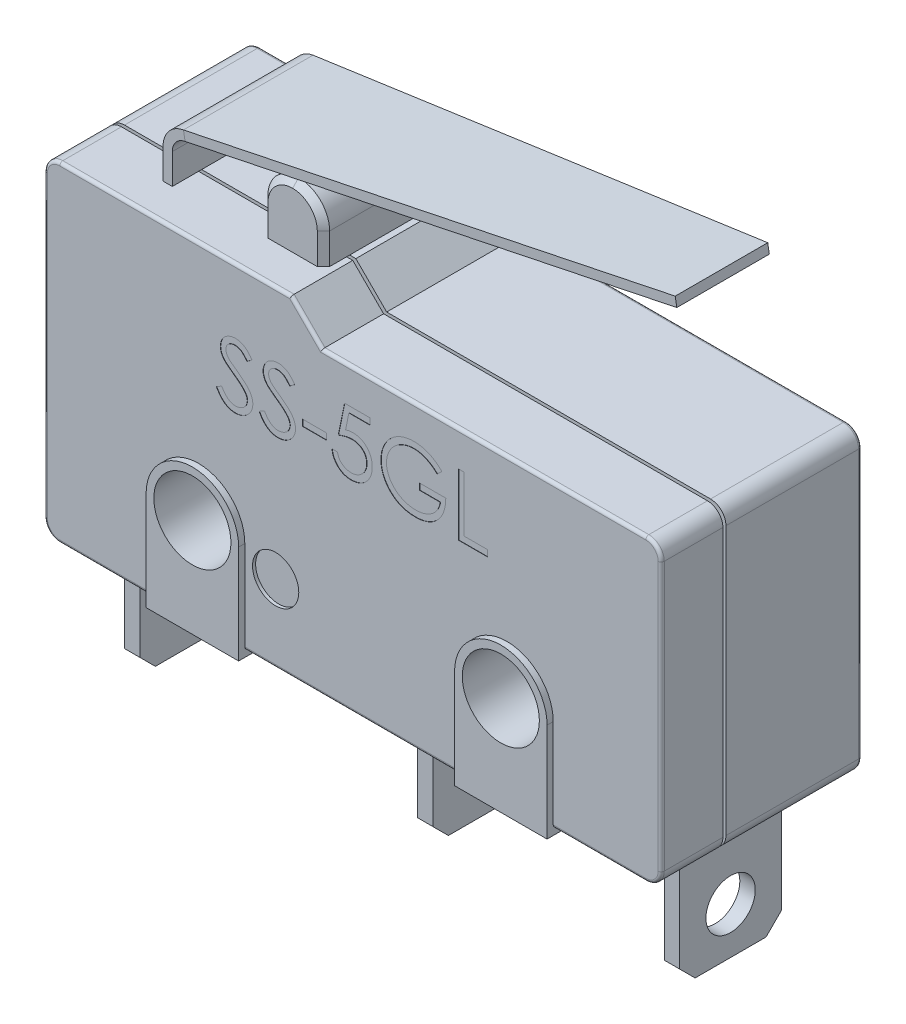
from build123d import *

# Parameters (mm, degrees)
EXTRUDE_1_DEPTH     = 6.5
SKETCH_2_R          = 1.25
CUT_EXTRUDE_1_DEPTH = 24.595338523
EXTRUDE_START       = 0.2
SKETCH_3_R          = 1.25
EXTRUDE_2_DEPTH     = 0.2
SKETCH_4_R          = 1.25
EXTRUDE_3_DEPTH     = 0.2
SKETCH_5_W          = 2
SKETCH_5_H          = 4
EXTRUDE_4_DEPTH     = 2
FILLET_1_R          = 1
EXTRUDE_5_DEPTH     = 4.2
CUT_EXTRUDE_2_DEPTH = 0.3
SKETCH_8_W          = 0.5
SKETCH_8_H          = 3.3
EXTRUDE_6_DEPTH     = 4
EXTRUDE_6_2_DEPTH   = 4
EXTRUDE_6_3_DEPTH   = 4
SKETCH_9_R          = 0.8
CUT_EXTRUDE_3_DEPTH = 26.221709024
CUT_EXTRUDE_4_DEPTH = 26.221709024
SKETCH_12_W         = 3
SKETCH_12_H         = 6.9
EXTRUDE_7_DEPTH     = 0.2
FILLET_2_R          = 0.5
SKETCH_13_W         = 0.769230769
SKETCH_13_H         = 0.205128205
CUT_EXTRUDE_5_DEPTH = 0.01
CHAMFER_2_SIZE      = 0.2
FILLET_3_R          = 0.1
SKETCH_14_R         = 0.75
CUT_EXTRUDE_6_DEPTH = 0.1
CUT_EXTRUDE_START   = -0.1
SKETCH_15_R         = 0.75
CUT_EXTRUDE_7_DEPTH = 0.1
CUT_EXTRUDE_8_DEPTH = 0.1


with BuildPart() as part:
    # 草圖1 → 填料-伸長1 (new body)
    with BuildSketch(Plane.XY):
        Polygon((20, 9.7), (9, 9.7), (8, 10.7), (0, 10.7), (0, 0), (20, 0), align=None)
    extrude(amount=EXTRUDE_1_DEPTH)

    # 草圖2 → 除料-伸長1 (cut, through all)
    with BuildSketch(Plane.XY.offset(6.5)):
        with Locations((5, 3)):
            Circle(SKETCH_2_R)
        with Locations((15, 3)):
            Circle(SKETCH_2_R)
    extrude(amount=-CUT_EXTRUDE_1_DEPTH, mode=Mode.SUBTRACT)

    # 草圖3 → 填料-伸長2 (add)
    # profile 1 of 2: a face of its own
    with BuildSketch(Plane.XY.offset(6.5).offset(EXTRUDE_START)):
        with BuildLine():
            Line((3.5, 3), (3.5, 0))
            Line((3.5, 0), (6.5, 0))
            Line((6.5, 0), (6.5, 3))
            ThreePointArc((6.5, 3), (5, 4.5), (3.5, 3))
        make_face()
        with Locations((5, 3)):
            Circle(SKETCH_3_R, mode=Mode.SUBTRACT)
    # profile 2 of 2: a face of its own
    with BuildSketch(Plane.XY.offset(6.5).offset(EXTRUDE_START)):
        with BuildLine():
            Line((13.5, 3), (13.5, 0))
            Line((13.5, 0), (16.5, 0))
            Line((16.5, 0), (16.5, 3))
            ThreePointArc((16.5, 3), (15, 4.5), (13.5, 3))
        make_face()
        with Locations((15, 3)):
            Circle(SKETCH_3_R, mode=Mode.SUBTRACT)
    extrude(amount=-EXTRUDE_2_DEPTH)

    # 草圖4 → 填料-伸長3 (add)
    # profile 1 of 2: a face of its own
    with BuildSketch(Plane(origin=(0, 0, 0), x_dir=(-1, 0, 0), z_dir=(0, 0, -1))):
        with BuildLine():
            Line((-16.5, 3), (-16.5, 0))
            Line((-16.5, 0), (-13.5, 0))
            Line((-13.5, 0), (-13.5, 3))
            ThreePointArc((-13.5, 3), (-15, 4.5), (-16.5, 3))
        make_face()
        with Locations(Location((-15, 3, 0), (0, 0, 180))):
            Circle(SKETCH_4_R, mode=Mode.SUBTRACT)
    # profile 2 of 2: a face of its own
    with BuildSketch(Plane(origin=(0, 0, 0), x_dir=(-1, 0, 0), z_dir=(0, 0, -1))):
        with BuildLine():
            Line((-6.5, 3), (-6.5, 0))
            Line((-6.5, 0), (-3.5, 0))
            Line((-3.5, 0), (-3.5, 3))
            ThreePointArc((-3.5, 3), (-5, 4.5), (-6.5, 3))
        make_face()
        with Locations(Location((-5, 3, 0), (0, 0, 180))):
            Circle(SKETCH_4_R, mode=Mode.SUBTRACT)
    extrude(amount=EXTRUDE_3_DEPTH)

    # 草圖12 → 填料-伸長7 (add)
    with BuildSketch(Plane.XZ):
        with Locations((5, 3.25)):
            Rectangle(SKETCH_12_W, SKETCH_12_H)
        with Locations((15, 3.25)):
            Rectangle(SKETCH_12_W, SKETCH_12_H)
    extrude(amount=EXTRUDE_7_DEPTH)

    # 圓角2
    fillet_2_edges = [part.edges().sort_by_distance(p)[0] for p in [
        (20, 9.7, 3.25),
        (20, 0, 3.25),
        (0, 0, 3.25),
        (0, 10.7, 3.25),
    ]]
    fillet(fillet_2_edges, radius=FILLET_2_R)

    # 草圖13 → 除料-伸長5 (cut)
    with BuildSketch(Plane.XY.offset(6.5)):
        with BuildLine():
            Line((5.580376832, 6.943678056), (5.749447345, 7.045040235))
            add(Edge.make_bspline(
                [(5.749447345, 7.045040235), (5.765172052, 7.01871773), (5.795299983, 6.968284825), (5.845557903, 6.900137373), (5.897633852, 6.84221614), (5.951913471, 6.794858079), (6.008065442, 6.757573001), (6.06645633, 6.731171726), (6.126889364, 6.714705454), (6.168017262, 6.712705404), (6.188549909, 6.711706902)],
                knots=[0, 0, 0, 0, 1.272034388, 2.437168799, 3.508375237, 4.49857839, 5.41946034, 6.295179144, 7.148887113, 8, 8, 8, 8], degree=3))
            add(Edge.make_bspline(
                [(6.188549909, 6.711706902), (6.206085258, 6.712195286), (6.240849128, 6.713163509), (6.292027552, 6.722466825), (6.341731439, 6.73675947), (6.388936375, 6.757228574), (6.432991012, 6.781993423), (6.47162341, 6.811905524), (6.505021188, 6.845394784), (6.532340683, 6.882756301), (6.553300703, 6.922937529), (6.569410456, 6.96418093), (6.578350498, 7.007134397), (6.579697214, 7.036054662), (6.580376832, 7.05064921)],
                knots=[0, 0, 0, 0, 1.095163259, 2.171163733, 3.241058638, 4.321873601, 5.38011039, 6.391990106, 7.366004449, 8.327778327, 9.272591725, 10.192022065, 11.087607919, 12, 12, 12, 12], degree=3))
            add(Edge.make_bspline(
                [(6.580376832, 7.05064921), (6.579534369, 7.067301124), (6.577821764, 7.101152032), (6.563346632, 7.151094691), (6.540575634, 7.200519016), (6.519568409, 7.231091168), (6.508662088, 7.246963312)],
                knots=[0, 0, 0, 0, 0.938893495, 1.908633276, 2.914225137, 4, 4, 4, 4], degree=3))
            add(Edge.make_bspline(
                [(6.508662088, 7.246963312), (6.499707452, 7.25841864), (6.480908312, 7.282467668), (6.448589733, 7.318264945), (6.410666239, 7.355189756), (6.368435637, 7.394652074), (6.320359586, 7.434816529), (6.267943863, 7.477598403), (6.20985023, 7.521370732), (6.16910766, 7.550726484), (6.148085165, 7.565873569)],
                knots=[0, 0, 0, 0, 0.722233717, 1.516239348, 2.393582979, 3.351407094, 4.387010283, 5.505090956, 6.712668013, 8, 8, 8, 8], degree=3))
            add(Edge.make_bspline(
                [(6.148085165, 7.565873569), (6.127042882, 7.580861333), (6.086811638, 7.609516797), (6.030549591, 7.652044959), (5.980238469, 7.690927171), (5.936101888, 7.726529463), (5.898159261, 7.758856666), (5.866111598, 7.787598345), (5.84077528, 7.813531809), (5.826686376, 7.830355433), (5.820360806, 7.837908825)],
                knots=[0, 0, 0, 0, 1.452282411, 2.77665338, 3.964542531, 5.026858415, 5.96415736, 6.766646006, 7.446254459, 8, 8, 8, 8], degree=3))
            add(Edge.make_bspline(
                [(5.820360806, 7.837908825), (5.811519352, 7.849680846), (5.794131445, 7.872832105), (5.771179442, 7.909017738), (5.751671349, 7.946059604), (5.736378588, 7.984057241), (5.723500748, 8.022477201), (5.714839074, 8.06182077), (5.709415418, 8.101911409), (5.708859997, 8.128890552), (5.70858196, 8.142396005)],
                knots=[0, 0, 0, 0, 1.068054152, 2.10047183, 3.106115577, 4.101338837, 5.06977816, 6.043150881, 7.020423561, 8, 8, 8, 8], degree=3))
            add(Edge.make_bspline(
                [(5.70858196, 8.142396005), (5.709327794, 8.163555876), (5.710803519, 8.205423341), (5.723283815, 8.266583815), (5.742982611, 8.324976054), (5.77057969, 8.380021959), (5.80615532, 8.430288233), (5.847324449, 8.476353083), (5.896359584, 8.515077987), (5.950161083, 8.548913449), (6.009050438, 8.575396835), (6.070759526, 8.595374538), (6.135386424, 8.606694114), (6.179159644, 8.608318551), (6.201370422, 8.609142799)],
                knots=[0, 0, 0, 0, 1.005424448, 1.989358655, 2.955360095, 3.929531133, 4.905563448, 5.876582895, 6.856512386, 7.866279853, 8.892233794, 9.918561126, 10.94386622, 12, 12, 12, 12], degree=3))
            add(Edge.make_bspline(
                [(6.201370422, 8.609142799), (6.224938479, 8.608329913), (6.271807823, 8.606713341), (6.340750232, 8.592657609), (6.407127784, 8.569400082), (6.460523935, 8.543006563), (6.502314085, 8.516645754), (6.534184218, 8.492634426), (6.566479904, 8.464991507), (6.599461649, 8.433643366), (6.632570598, 8.398302365), (6.666298285, 8.359210543), (6.700723581, 8.316606797), (6.722869787, 8.286192796), (6.734222986, 8.270601133)],
                knots=[0, 0, 0, 0, 1.286793592, 2.559021753, 3.825965368, 5.121522368, 5.803751409, 6.523245864, 7.299691795, 8.125521123, 9.008227632, 9.944561021, 10.946284179, 12, 12, 12, 12], degree=3))
            Line((6.734222986, 8.270601133), (6.57196337, 8.147604338))
            add(Edge.make_bspline(
                [(6.57196337, 8.147604338), (6.562165695, 8.160226447), (6.543297662, 8.184533677), (6.514652241, 8.218574429), (6.487653014, 8.24966956), (6.461052785, 8.276678205), (6.436256424, 8.301079424), (6.412189543, 8.321970713), (6.389198485, 8.339556768), (6.360217393, 8.358324516), (6.323807269, 8.376928233), (6.278101819, 8.392670563), (6.230338234, 8.402130598), (6.197807016, 8.403381391), (6.18133837, 8.404014594)],
                knots=[0, 0, 0, 0, 1.181633172, 2.275549214, 3.290209073, 4.226197932, 5.078386478, 5.862611352, 6.581680152, 7.217281963, 8.414376989, 9.595101626, 10.782541182, 12, 12, 12, 12], degree=3))
            add(Edge.make_bspline(
                [(6.18133837, 8.404014594), (6.1606775, 8.403322194), (6.120834959, 8.401986966), (6.06426911, 8.387404117), (6.013358295, 8.364443054), (5.969613973, 8.332263067), (5.933192843, 8.294136785), (5.906846866, 8.250263154), (5.890989629, 8.201816067), (5.889054613, 8.168020835), (5.88806914, 8.150809466)],
                knots=[0, 0, 0, 0, 1.14458467, 2.207223713, 3.21896685, 4.227309161, 5.202851033, 6.127160689, 7.046193047, 8, 8, 8, 8], degree=3))
            add(Edge.make_bspline(
                [(5.88806914, 8.150809466), (5.888293783, 8.140094335), (5.888743438, 8.118646553), (5.895014751, 8.086960026), (5.903071511, 8.055353546), (5.915838729, 8.023969213), (5.933464617, 7.992258151), (5.956610431, 7.959674301), (5.985760895, 7.925930468), (6.008090617, 7.903983397), (6.019880037, 7.892396005)],
                knots=[0, 0, 0, 0, 0.858281714, 1.717966888, 2.583508476, 3.4729293, 4.427298488, 5.488583878, 6.674047936, 8, 8, 8, 8], degree=3))
            add(Edge.make_bspline(
                [(6.019880037, 7.892396005), (6.024257964, 7.888489133), (6.034658917, 7.879207299), (6.053673731, 7.86401171), (6.078783902, 7.845267269), (6.109333731, 7.822074517), (6.145886509, 7.795170824), (6.188446256, 7.764900189), (6.23653856, 7.730279926), (6.270665369, 7.706075617), (6.288710165, 7.693277415)],
                knots=[0, 0, 0, 0, 0.420754252, 0.999615792, 1.744751191, 2.668019286, 3.750313428, 4.999500688, 6.413464383, 8, 8, 8, 8], degree=3))
            add(Edge.make_bspline(
                [(6.288710165, 7.693277415), (6.310416401, 7.677482352), (6.352447519, 7.646897403), (6.412251851, 7.600945585), (6.466476884, 7.556004003), (6.515313, 7.512359656), (6.559242662, 7.470343603), (6.597778503, 7.429450357), (6.631313177, 7.389972887), (6.667415588, 7.339359987), (6.70430577, 7.277199367), (6.735986632, 7.201040374), (6.75596283, 7.124585334), (6.758575125, 7.07319857), (6.759864011, 7.047844722)],
                knots=[0, 0, 0, 0, 1.163667725, 2.253281268, 3.268753668, 4.215851969, 5.092017293, 5.902905408, 6.650798638, 7.335211899, 8.59617414, 9.77448103, 10.901945474, 12, 12, 12, 12], degree=3))
            add(Edge.make_bspline(
                [(6.759864011, 7.047844722), (6.759488504, 7.029914228), (6.758744781, 6.994401438), (6.750195687, 6.942255679), (6.737670164, 6.891609468), (6.718791745, 6.843088832), (6.69574994, 6.795806111), (6.666512084, 6.751001596), (6.632621979, 6.707683654), (6.593745542, 6.667007374), (6.551205026, 6.62966669), (6.506242915, 6.596450084), (6.458785616, 6.568753899), (6.409090578, 6.546153418), (6.357146386, 6.528477122), (6.302970509, 6.515669768), (6.246473645, 6.507809362), (6.20807337, 6.506993498), (6.188549909, 6.506578697)],
                knots=[0, 0, 0, 0, 0.983748083, 1.948392443, 2.894712957, 3.844097841, 4.80183111, 5.778335162, 6.776009319, 7.81870978, 8.863265674, 9.881300176, 10.883814829, 11.87499822, 12.874611388, 13.892143829, 14.928324115, 16, 16, 16, 16], degree=3))
            add(Edge.make_bspline(
                [(6.188549909, 6.506578697), (6.173443998, 6.506870801), (6.143422421, 6.507451329), (6.099017003, 6.51258349), (6.055508666, 6.519844692), (6.013443362, 6.531372732), (5.972279127, 6.545359576), (5.932194993, 6.56258148), (5.893171534, 6.583219881), (5.854990058, 6.606817038), (5.817747672, 6.634278606), (5.781793691, 6.666263461), (5.745948442, 6.701889464), (5.71126993, 6.742124072), (5.677056704, 6.786317262), (5.643983327, 6.83488251), (5.611365203, 6.887555283), (5.590899221, 6.924621046), (5.580376832, 6.943678056)],
                knots=[0, 0, 0, 0, 0.915332311, 1.819136955, 2.706846663, 3.586547465, 4.459518054, 5.340707479, 6.227863349, 7.133153174, 8.059268498, 9.028702269, 10.047606654, 11.120612155, 12.245963614, 13.433783089, 14.680604001, 16, 16, 16, 16], degree=3))
        make_face()
        with BuildLine():
            Line((6.964992216, 6.943678056), (7.134062729, 7.045040235))
            add(Edge.make_bspline(
                [(7.134062729, 7.045040235), (7.149787436, 7.01871773), (7.179915368, 6.968284825), (7.230173288, 6.900137373), (7.282249237, 6.84221614), (7.336528856, 6.794858079), (7.392680826, 6.757573001), (7.451071714, 6.731171726), (7.511504749, 6.714705454), (7.552632647, 6.712705404), (7.573165293, 6.711706902)],
                knots=[0, 0, 0, 0, 1.272034388, 2.437168799, 3.508375237, 4.49857839, 5.41946034, 6.295179144, 7.148887113, 8, 8, 8, 8], degree=3))
            add(Edge.make_bspline(
                [(7.573165293, 6.711706902), (7.590700642, 6.712195286), (7.625464513, 6.713163509), (7.676642937, 6.722466825), (7.726346824, 6.73675947), (7.77355176, 6.757228574), (7.817606397, 6.781993423), (7.856238794, 6.811905524), (7.889636573, 6.845394784), (7.916956067, 6.882756301), (7.937916087, 6.922937529), (7.954025841, 6.96418093), (7.962965883, 7.007134397), (7.964312599, 7.036054662), (7.964992216, 7.05064921)],
                knots=[0, 0, 0, 0, 1.095163259, 2.171163733, 3.241058638, 4.321873601, 5.38011039, 6.391990106, 7.366004449, 8.327778327, 9.272591725, 10.192022065, 11.087607919, 12, 12, 12, 12], degree=3))
            add(Edge.make_bspline(
                [(7.964992216, 7.05064921), (7.964149753, 7.067301124), (7.962437148, 7.101152032), (7.947962017, 7.151094691), (7.925191019, 7.200519016), (7.904183794, 7.231091168), (7.893277473, 7.246963312)],
                knots=[0, 0, 0, 0, 0.938893495, 1.908633276, 2.914225137, 4, 4, 4, 4], degree=3))
            add(Edge.make_bspline(
                [(7.893277473, 7.246963312), (7.884322836, 7.25841864), (7.865523697, 7.282467668), (7.833205118, 7.318264945), (7.795281624, 7.355189756), (7.753051021, 7.394652074), (7.70497497, 7.434816529), (7.652559248, 7.477598403), (7.594465614, 7.521370732), (7.553723045, 7.550726484), (7.53270055, 7.565873569)],
                knots=[0, 0, 0, 0, 0.722233717, 1.516239348, 2.393582979, 3.351407094, 4.387010283, 5.505090956, 6.712668013, 8, 8, 8, 8], degree=3))
            add(Edge.make_bspline(
                [(7.53270055, 7.565873569), (7.511658266, 7.580861333), (7.471427022, 7.609516797), (7.415164975, 7.652044959), (7.364853854, 7.690927171), (7.320717273, 7.726529463), (7.282774646, 7.758856666), (7.250726983, 7.787598345), (7.225390664, 7.813531809), (7.211301761, 7.830355433), (7.204976191, 7.837908825)],
                knots=[0, 0, 0, 0, 1.452282411, 2.77665338, 3.964542531, 5.026858415, 5.96415736, 6.766646006, 7.446254459, 8, 8, 8, 8], degree=3))
            add(Edge.make_bspline(
                [(7.204976191, 7.837908825), (7.196134736, 7.849680846), (7.17874683, 7.872832105), (7.155794827, 7.909017738), (7.136286734, 7.946059604), (7.120993972, 7.984057241), (7.108116133, 8.022477201), (7.099454458, 8.06182077), (7.094030803, 8.101911409), (7.093475382, 8.128890552), (7.093197345, 8.142396005)],
                knots=[0, 0, 0, 0, 1.068054152, 2.10047183, 3.106115577, 4.101338837, 5.06977816, 6.043150881, 7.020423561, 8, 8, 8, 8], degree=3))
            add(Edge.make_bspline(
                [(7.093197345, 8.142396005), (7.093943178, 8.163555876), (7.095418904, 8.205423341), (7.1078992, 8.266583815), (7.127597996, 8.324976054), (7.155195075, 8.380021959), (7.190770705, 8.430288233), (7.231939833, 8.476353083), (7.280974968, 8.515077987), (7.334776467, 8.548913449), (7.393665823, 8.575396835), (7.45537491, 8.595374538), (7.520001809, 8.606694114), (7.563775029, 8.608318551), (7.585985806, 8.609142799)],
                knots=[0, 0, 0, 0, 1.005424448, 1.989358655, 2.955360095, 3.929531133, 4.905563448, 5.876582895, 6.856512386, 7.866279853, 8.892233794, 9.918561126, 10.94386622, 12, 12, 12, 12], degree=3))
            add(Edge.make_bspline(
                [(7.585985806, 8.609142799), (7.609553863, 8.608329913), (7.656423207, 8.606713341), (7.725365616, 8.592657609), (7.791743168, 8.569400082), (7.84513932, 8.543006563), (7.886929469, 8.516645754), (7.918799602, 8.492634426), (7.951095288, 8.464991507), (7.984077034, 8.433643366), (8.017185982, 8.398302365), (8.050913669, 8.359210543), (8.085338966, 8.316606797), (8.107485171, 8.286192796), (8.11883837, 8.270601133)],
                knots=[0, 0, 0, 0, 1.286793592, 2.559021753, 3.825965368, 5.121522368, 5.803751409, 6.523245864, 7.299691795, 8.125521123, 9.008227632, 9.944561021, 10.946284179, 12, 12, 12, 12], degree=3))
            Line((8.11883837, 8.270601133), (7.956578755, 8.147604338))
            add(Edge.make_bspline(
                [(7.956578755, 8.147604338), (7.946781079, 8.160226447), (7.927913047, 8.184533677), (7.899267626, 8.218574429), (7.872268398, 8.24966956), (7.84566817, 8.276678205), (7.820871809, 8.301079424), (7.796804928, 8.321970713), (7.77381387, 8.339556768), (7.744832778, 8.358324516), (7.708422653, 8.376928233), (7.662717204, 8.392670563), (7.614953618, 8.402130598), (7.5824224, 8.403381391), (7.565953755, 8.404014594)],
                knots=[0, 0, 0, 0, 1.181633172, 2.275549214, 3.290209073, 4.226197932, 5.078386478, 5.862611352, 6.581680152, 7.217281963, 8.414376989, 9.595101626, 10.782541182, 12, 12, 12, 12], degree=3))
            add(Edge.make_bspline(
                [(7.565953755, 8.404014594), (7.545292885, 8.403322194), (7.505450344, 8.401986966), (7.448884494, 8.387404117), (7.39797368, 8.364443054), (7.354229357, 8.332263067), (7.317808227, 8.294136785), (7.291462251, 8.250263154), (7.275605014, 8.201816067), (7.273669997, 8.168020835), (7.272684524, 8.150809466)],
                knots=[0, 0, 0, 0, 1.14458467, 2.207223713, 3.21896685, 4.227309161, 5.202851033, 6.127160689, 7.046193047, 8, 8, 8, 8], degree=3))
            add(Edge.make_bspline(
                [(7.272684524, 8.150809466), (7.272909168, 8.140094335), (7.273358823, 8.118646553), (7.279630136, 8.086960026), (7.287686895, 8.055353546), (7.300454113, 8.023969213), (7.318080001, 7.992258151), (7.341225816, 7.959674301), (7.37037628, 7.925930468), (7.392706001, 7.903983397), (7.404495422, 7.892396005)],
                knots=[0, 0, 0, 0, 0.858281714, 1.717966888, 2.583508476, 3.4729293, 4.427298488, 5.488583878, 6.674047936, 8, 8, 8, 8], degree=3))
            add(Edge.make_bspline(
                [(7.404495422, 7.892396005), (7.408873349, 7.888489133), (7.419274301, 7.879207299), (7.438289116, 7.86401171), (7.463399286, 7.845267269), (7.493949116, 7.822074517), (7.530501894, 7.795170824), (7.57306164, 7.764900189), (7.621153945, 7.730279926), (7.655280754, 7.706075617), (7.67332555, 7.693277415)],
                knots=[0, 0, 0, 0, 0.420754252, 0.999615792, 1.744751191, 2.668019286, 3.750313428, 4.999500688, 6.413464383, 8, 8, 8, 8], degree=3))
            add(Edge.make_bspline(
                [(7.67332555, 7.693277415), (7.695031786, 7.677482352), (7.737062904, 7.646897403), (7.796867235, 7.600945585), (7.851092268, 7.556004003), (7.899928385, 7.512359656), (7.943858047, 7.470343603), (7.982393887, 7.429450357), (8.015928562, 7.389972887), (8.052030972, 7.339359987), (8.088921155, 7.277199367), (8.120602016, 7.201040374), (8.140578215, 7.124585334), (8.143190509, 7.07319857), (8.144479396, 7.047844722)],
                knots=[0, 0, 0, 0, 1.163667725, 2.253281268, 3.268753668, 4.215851969, 5.092017293, 5.902905408, 6.650798638, 7.335211899, 8.59617414, 9.77448103, 10.901945474, 12, 12, 12, 12], degree=3))
            add(Edge.make_bspline(
                [(8.144479396, 7.047844722), (8.144103888, 7.029914228), (8.143360166, 6.994401438), (8.134811072, 6.942255679), (8.122285549, 6.891609468), (8.10340713, 6.843088832), (8.080365325, 6.795806111), (8.051127469, 6.751001596), (8.017237363, 6.707683654), (7.978360926, 6.667007374), (7.935820411, 6.62966669), (7.890858299, 6.596450084), (7.843401001, 6.568753899), (7.793705963, 6.546153418), (7.74176177, 6.528477122), (7.687585894, 6.515669768), (7.63108903, 6.507809362), (7.592688755, 6.506993498), (7.573165293, 6.506578697)],
                knots=[0, 0, 0, 0, 0.983748083, 1.948392443, 2.894712957, 3.844097841, 4.80183111, 5.778335162, 6.776009319, 7.81870978, 8.863265674, 9.881300176, 10.883814829, 11.87499822, 12.874611388, 13.892143829, 14.928324115, 16, 16, 16, 16], degree=3))
            add(Edge.make_bspline(
                [(7.573165293, 6.506578697), (7.558059383, 6.506870801), (7.528037806, 6.507451329), (7.483632388, 6.51258349), (7.440124051, 6.519844692), (7.398058747, 6.531372732), (7.356894512, 6.545359576), (7.316810378, 6.56258148), (7.277786918, 6.583219881), (7.239605442, 6.606817038), (7.202363057, 6.634278606), (7.166409075, 6.666263461), (7.130563826, 6.701889464), (7.095885314, 6.742124072), (7.061672089, 6.786317262), (7.028598712, 6.83488251), (6.995980588, 6.887555283), (6.975514606, 6.924621046), (6.964992216, 6.943678056)],
                knots=[0, 0, 0, 0, 0.915332311, 1.819136955, 2.706846663, 3.586547465, 4.459518054, 5.340707479, 6.227863349, 7.133153174, 8.059268498, 9.028702269, 10.047606654, 11.120612155, 12.245963614, 13.433783089, 14.680604001, 16, 16, 16, 16], degree=3))
        make_face()
        with Locations((8.759864012, 7.327091518)):
            Rectangle(SKETCH_13_W, SKETCH_13_H)
        with BuildLine():
            Line((10.554735806, 8.557860748), (10.554735806, 8.352732543))
            Line((10.554735806, 8.352732543), (9.874447345, 8.352732543))
            Line((9.874447345, 8.352732543), (9.766674909, 7.826690876))
            add(Edge.make_bspline(
                [(9.766674909, 7.826690876), (9.787849694, 7.832536746), (9.828872492, 7.843862194), (9.889420984, 7.85643692), (9.946902243, 7.864017173), (9.984202454, 7.865052208), (10.002251832, 7.865553056)],
                knots=[0, 0, 0, 0, 1.100273476, 2.13160584, 3.095893838, 4, 4, 4, 4], degree=3))
            add(Edge.make_bspline(
                [(10.002251832, 7.865553056), (10.024585397, 7.865069664), (10.068498767, 7.864119195), (10.132749594, 7.854992424), (10.194082676, 7.840626758), (10.252369745, 7.820557889), (10.307718631, 7.794895184), (10.359620094, 7.762838075), (10.408853188, 7.725390457), (10.45453467, 7.682336165), (10.495977132, 7.634952384), (10.53241484, 7.584005029), (10.563364892, 7.529989222), (10.588256752, 7.472388874), (10.608133514, 7.411840787), (10.621363225, 7.347707882), (10.630172773, 7.280594671), (10.631156994, 7.234706345), (10.631658883, 7.211306261)],
                knots=[0, 0, 0, 0, 1.052922333, 2.070308379, 3.05430497, 4.020497103, 4.973039431, 5.925935799, 6.892292201, 7.88610001, 8.88166317, 9.857072816, 10.836096531, 11.812156883, 12.81219415, 13.836441305, 14.89672472, 16, 16, 16, 16], degree=3))
            add(Edge.make_bspline(
                [(10.631658883, 7.211306261), (10.63127884, 7.195007849), (10.63052389, 7.162631285), (10.626684697, 7.114548885), (10.619292859, 7.067484409), (10.609368446, 7.021431613), (10.596487064, 6.976477686), (10.580893319, 6.932493956), (10.561809874, 6.889754181), (10.54087766, 6.847853955), (10.517308244, 6.807740522), (10.491149097, 6.770226816), (10.463511673, 6.734750083), (10.433773739, 6.701690807), (10.401658885, 6.671266226), (10.367556046, 6.643295779), (10.33173735, 6.617306448), (10.29364864, 6.594353193), (10.25413865, 6.573231504), (10.212636811, 6.555903768), (10.17008784, 6.540412038), (10.125879339, 6.528063737), (10.080111446, 6.518387991), (10.032708717, 6.511816219), (9.983919763, 6.507029684), (9.950848327, 6.506730051), (9.934142857, 6.506578697)],
                knots=[0, 0, 0, 0, 1.056347294, 2.098418968, 3.122841568, 4.141288669, 5.149314143, 6.15115421, 7.162517403, 8.180376062, 9.185164535, 10.17417709, 11.141909838, 12.097768115, 13.052685741, 14.0056014, 14.954263652, 15.917497458, 16.885230207, 17.854509472, 18.828990115, 19.81800267, 20.826176721, 21.857883937, 22.917946725, 24, 24, 24, 24], degree=3))
            add(Edge.make_bspline(
                [(9.934142857, 6.506578697), (9.914214754, 6.506973461), (9.875008565, 6.507750114), (9.817568241, 6.515874963), (9.762302752, 6.527511486), (9.70965698, 6.545017926), (9.659159115, 6.566953523), (9.611488991, 6.59467705), (9.565428547, 6.626093681), (9.522850241, 6.663168168), (9.483332461, 6.703691415), (9.447957313, 6.74766721), (9.416452412, 6.794369748), (9.389322271, 6.844025836), (9.366180545, 6.896504997), (9.348000552, 6.952003854), (9.333327206, 7.010232428), (9.327119537, 7.050320148), (9.323966575, 7.070681261)],
                knots=[0, 0, 0, 0, 1.0467383, 2.05933395, 3.04377827, 4.011590433, 4.970194871, 5.932262533, 6.905835911, 7.896367577, 8.894135286, 9.877477877, 10.858688626, 11.851381753, 12.8477658, 13.868841284, 14.917554742, 16, 16, 16, 16], degree=3))
            Line((9.323966575, 7.070681261), (9.503453755, 7.070681261))
            add(Edge.make_bspline(
                [(9.503453755, 7.070681261), (9.507870073, 7.051609002), (9.516358483, 7.014951062), (9.534990339, 6.963447439), (9.55777084, 6.91755074), (9.584859039, 6.876653835), (9.617173342, 6.840991551), (9.654047301, 6.809210372), (9.695388857, 6.78053887), (9.741327846, 6.756640146), (9.789792462, 6.736258001), (9.840516582, 6.722685604), (9.892119066, 6.713142237), (9.927020992, 6.712186945), (9.944559524, 6.711706902)],
                knots=[0, 0, 0, 0, 1.136247022, 2.183929868, 3.172523383, 4.106158343, 5.02341133, 5.958108904, 6.928429099, 7.938127109, 8.96079061, 9.975095812, 10.982467395, 12, 12, 12, 12], degree=3))
            add(Edge.make_bspline(
                [(9.944559524, 6.711706902), (9.961678635, 6.712175918), (9.995386305, 6.713099414), (10.044992812, 6.720207421), (10.092885883, 6.731154605), (10.138592944, 6.747537379), (10.182913823, 6.767448647), (10.224727407, 6.793000118), (10.265243336, 6.822405843), (10.30320227, 6.856095346), (10.337967669, 6.893220886), (10.368685453, 6.932922254), (10.394272261, 6.975274737), (10.415834608, 7.01954511), (10.432207922, 7.066218572), (10.443888483, 7.115076386), (10.450747374, 7.166239232), (10.451690905, 7.20113598), (10.452171704, 7.21891844)],
                knots=[0, 0, 0, 0, 1.027316725, 2.022795036, 3.002884548, 3.971462791, 4.93288096, 5.914575861, 6.907176829, 7.935150275, 8.956128384, 9.956726525, 10.942570165, 11.921478529, 12.907843606, 13.90538589, 14.932640048, 16, 16, 16, 16], degree=3))
            add(Edge.make_bspline(
                [(10.452171704, 7.21891844), (10.45179543, 7.234961727), (10.451058927, 7.266364178), (10.445041458, 7.312306582), (10.434574617, 7.355776892), (10.420046685, 7.396985025), (10.401601252, 7.435969849), (10.379060502, 7.472771598), (10.352001418, 7.506905217), (10.321091767, 7.538386676), (10.28723003, 7.56744089), (10.249833605, 7.59220894), (10.209685076, 7.613045464), (10.167268162, 7.631027178), (10.121573934, 7.643941889), (10.073507287, 7.653637824), (10.022549168, 7.659246602), (9.987708775, 7.660024824), (9.969799909, 7.660424851)],
                knots=[0, 0, 0, 0, 1.045622112, 2.046656509, 3.013763289, 3.955457236, 4.890082067, 5.820317437, 6.762574623, 7.722996705, 8.69280354, 9.665887285, 10.63943826, 11.638615906, 12.663482002, 13.728887084, 14.832589034, 16, 16, 16, 16], degree=3))
            add(Edge.make_bspline(
                [(9.969799909, 7.660424851), (9.954297664, 7.660093084), (9.922289461, 7.659408071), (9.873190703, 7.654364358), (9.821595432, 7.646227619), (9.767701435, 7.635035477), (9.711346859, 7.620389148), (9.65265063, 7.602838005), (9.591489335, 7.581854005), (9.550279206, 7.566007026), (9.529094781, 7.557860748)],
                knots=[0, 0, 0, 0, 0.817624296, 1.688186739, 2.600797293, 3.572016777, 4.590301741, 5.671205678, 6.80286297, 8, 8, 8, 8], degree=3))
            Line((9.529094781, 7.557860748), (9.734222986, 8.557860748))
            Line((9.734222986, 8.557860748), (10.554735806, 8.557860748))
        make_face()
        with BuildLine():
            Line((12.88806914, 8.216514594), (12.734222986, 8.070681261))
            add(Edge.make_bspline(
                [(12.734222986, 8.070681261), (12.706383621, 8.096870326), (12.651368737, 8.148623961), (12.56167717, 8.215773102), (12.468097951, 8.273296587), (12.371119381, 8.320100151), (12.273143064, 8.357444586), (12.175469478, 8.384032094), (12.079100506, 8.40098783), (12.015004952, 8.40301547), (11.983421704, 8.404014594)],
                knots=[0, 0, 0, 0, 1.08915593, 2.152340314, 3.188132944, 4.216796309, 5.218260357, 6.173443236, 7.099959455, 8, 8, 8, 8], degree=3))
            add(Edge.make_bspline(
                [(11.983421704, 8.404014594), (11.964041875, 8.403778248), (11.92533248, 8.403306169), (11.867834227, 8.397280903), (11.810939006, 8.388615266), (11.75475422, 8.37607705), (11.699170628, 8.360186159), (11.644381547, 8.340308752), (11.590284772, 8.317134326), (11.537389869, 8.29035577), (11.486109581, 8.260938715), (11.437677104, 8.228339549), (11.391783733, 8.193603097), (11.349292061, 8.15585968), (11.309957669, 8.115451186), (11.272844313, 8.073129297), (11.239257287, 8.027737743), (11.208919479, 7.980111671), (11.181855697, 7.931087563), (11.157965038, 7.881137283), (11.137909559, 7.830426509), (11.122041299, 7.778891608), (11.108949496, 7.726931271), (11.099739435, 7.674185716), (11.094547022, 7.620598467), (11.093648862, 7.58471432), (11.093197345, 7.566674851)],
                knots=[0, 0, 0, 0, 1.02818874, 2.053710826, 3.065248034, 4.081641283, 5.106893873, 6.131558223, 7.173050175, 8.228653731, 9.27666206, 10.308777013, 11.325269123, 12.329503258, 13.32196095, 14.316845687, 15.314881793, 16.315733098, 17.311955233, 18.285320748, 19.252783886, 20.203351036, 21.145449891, 22.095197417, 23.042428769, 24, 24, 24, 24], degree=3))
            add(Edge.make_bspline(
                [(11.093197345, 7.566674851), (11.093629184, 7.548234384), (11.094491682, 7.511403804), (11.100011865, 7.456435763), (11.110256574, 7.402284104), (11.123952408, 7.348770886), (11.141084302, 7.295804458), (11.162440111, 7.243614453), (11.18773474, 7.1922028), (11.21701277, 7.142032734), (11.249119172, 7.093162435), (11.285086647, 7.047128422), (11.323292695, 7.003317692), (11.365129209, 6.96270297), (11.409254661, 6.924197887), (11.456987391, 6.888863303), (11.507388797, 6.856018604), (11.560535775, 6.826077735), (11.61585165, 6.799330001), (11.672569795, 6.775544917), (11.730871404, 6.755956724), (11.790450084, 6.739992094), (11.85123481, 6.726906209), (11.913534126, 6.718487649), (11.97688996, 6.712378603), (12.019597749, 6.711931934), (12.041114011, 6.711706902)],
                knots=[0, 0, 0, 0, 0.93586088, 1.869166235, 2.799637598, 3.729985548, 4.670839027, 5.622275134, 6.589130586, 7.576015415, 8.568469353, 9.55398029, 10.53834874, 11.515998671, 12.510579167, 13.508179873, 14.527009472, 15.561807829, 16.601455013, 17.643573243, 18.680854198, 19.719860599, 20.772568776, 21.833555941, 22.908541556, 24, 24, 24, 24], degree=3))
            add(Edge.make_bspline(
                [(12.041114011, 6.711706902), (12.067044495, 6.712248946), (12.117963214, 6.713313336), (12.19281261, 6.721599216), (12.264700079, 6.734540241), (12.333423623, 6.753492182), (12.399063064, 6.77766571), (12.46185903, 6.806805931), (12.521317121, 6.842030536), (12.577616077, 6.881787032), (12.629477326, 6.926081222), (12.676251111, 6.973878053), (12.717191391, 7.02494552), (12.752908362, 7.078982843), (12.782456164, 7.136437303), (12.80670919, 7.197027339), (12.825299642, 7.260780203), (12.832931057, 7.304832564), (12.836787088, 7.327091517)],
                knots=[0, 0, 0, 0, 1.13008108, 2.219097802, 3.278683437, 4.311054135, 5.322181354, 6.324827112, 7.324222904, 8.330512327, 9.32562643, 10.293043162, 11.24128371, 12.174520618, 13.111833804, 14.052305215, 15.015860969, 16, 16, 16, 16], degree=3))
            Line((12.836787088, 7.327091517), (12.170120422, 7.327091517))
            Line((12.170120422, 7.327091517), (12.170120422, 7.532219722))
            Line((12.170120422, 7.532219722), (13.016274268, 7.532219722))
            add(Edge.make_bspline(
                [(13.016274268, 7.532219722), (13.015299497, 7.493986872), (13.013391695, 7.419158276), (13.000009458, 7.310032407), (12.978400022, 7.206962868), (12.948879844, 7.109841113), (12.910665398, 7.018804774), (12.86416681, 6.933761422), (12.808639884, 6.855260462), (12.746062489, 6.782661031), (12.675833942, 6.717901481), (12.599851873, 6.660983803), (12.517990748, 6.613039451), (12.430328001, 6.574033358), (12.337150611, 6.543591075), (12.238242965, 6.522007317), (12.133739193, 6.50907591), (12.062118235, 6.507423693), (12.025489011, 6.506578697)],
                knots=[0, 0, 0, 0, 1.140356446, 2.231883559, 3.274166699, 4.278491846, 5.25512956, 6.21435461, 7.1637429, 8.11826594, 9.068280886, 10.0076534, 10.945064095, 11.891975133, 12.864533718, 13.863980011, 14.907571808, 16, 16, 16, 16], degree=3))
            add(Edge.make_bspline(
                [(12.025489011, 6.506578697), (12.002911791, 6.506903909), (11.958382236, 6.507545332), (11.892615992, 6.512103816), (11.828663066, 6.519121289), (11.766532775, 6.529718502), (11.705996579, 6.542698304), (11.647356817, 6.559319286), (11.590390107, 6.578558543), (11.535008401, 6.600441785), (11.481714374, 6.625797018), (11.43027065, 6.653973954), (11.380392864, 6.684827303), (11.33242077, 6.718890644), (11.286104414, 6.755909193), (11.241742447, 6.795957146), (11.199086516, 6.838912072), (11.172366251, 6.869414363), (11.158902473, 6.884783825)],
                knots=[0, 0, 0, 0, 1.107784379, 2.184907829, 3.233506516, 4.263428166, 5.276301166, 6.270063455, 7.25232949, 8.225834625, 9.190232166, 10.146266622, 11.1027726, 12.066435141, 13.031522626, 14.010570082, 14.99756817, 16, 16, 16, 16], degree=3))
            add(Edge.make_bspline(
                [(11.158902473, 6.884783825), (11.139367655, 6.909167055), (11.100622276, 6.957528779), (11.050749044, 7.035014462), (11.008233956, 7.115244096), (10.973738058, 7.198441027), (10.946802009, 7.284527434), (10.92748415, 7.373393315), (10.916165699, 7.465153104), (10.914535106, 7.527247541), (10.913710165, 7.55866203)],
                knots=[0, 0, 0, 0, 1.023165419, 2.029347347, 3.013907458, 3.994755782, 4.975994455, 5.96558838, 6.970761222, 8, 8, 8, 8], degree=3))
            add(Edge.make_bspline(
                [(10.913710165, 7.55866203), (10.914014301, 7.582185603), (10.914618708, 7.628933779), (10.921947574, 7.698337955), (10.93246267, 7.766509779), (10.94791813, 7.833393525), (10.96740171, 7.899033863), (10.991717988, 7.963461271), (11.020029357, 8.026713769), (11.052935355, 8.088355979), (11.089555046, 8.14756993), (11.129298029, 8.204117246), (11.172728658, 8.25696814), (11.219137686, 8.306791939), (11.269078823, 8.352962709), (11.322084208, 8.395907915), (11.37819469, 8.435685164), (11.437586793, 8.471667927), (11.499374041, 8.503989995), (11.563408327, 8.532326688), (11.629670105, 8.555745725), (11.697662949, 8.575616457), (11.767901521, 8.590310823), (11.839876114, 8.600967249), (11.913961892, 8.60825902), (11.964039623, 8.608845452), (11.989431319, 8.609142799)],
                knots=[0, 0, 0, 0, 1.008945113, 2.00506715, 2.99143336, 3.967273523, 4.948097931, 5.927297278, 6.919902385, 7.919676788, 8.923139349, 9.905703106, 10.883022732, 11.856032218, 12.825136022, 13.798837087, 14.781400844, 15.773989409, 16.776158564, 17.77167057, 18.775803737, 19.789618931, 20.80898985, 21.851988756, 22.910860228, 24, 24, 24, 24], degree=3))
            add(Edge.make_bspline(
                [(11.989431319, 8.609142799), (12.010138887, 8.608811661), (12.05119956, 8.608155053), (12.112299979, 8.603603826), (12.172455987, 8.596390179), (12.231756781, 8.586546301), (12.290000419, 8.573138478), (12.347352822, 8.557093744), (12.403897129, 8.538412703), (12.459456128, 8.516133362), (12.514403395, 8.490845576), (12.569044446, 8.462380763), (12.623192587, 8.430252189), (12.676941719, 8.394364455), (12.730630781, 8.35533393), (12.783410576, 8.312044317), (12.836555116, 8.266202742), (12.870727581, 8.233241494), (12.88806914, 8.216514594)],
                knots=[0, 0, 0, 0, 0.985871117, 1.954866573, 2.915460327, 3.869826059, 4.81536089, 5.759505086, 6.70452669, 7.649098992, 8.607881297, 9.583363685, 10.581137262, 11.603961102, 12.659522466, 13.73993555, 14.853081303, 16, 16, 16, 16], degree=3))
        make_face()
        Polygon((13.426530678, 8.557860748), (13.606017857, 8.557860748), (13.606017857, 6.762988953), (14.375248627, 6.762988953), (14.375248627, 6.557860748), (13.426530678, 6.557860748), align=None)
    extrude(amount=-CUT_EXTRUDE_5_DEPTH, mode=Mode.SUBTRACT)

    # 圓角3
    fillet_3_edges = [part.edges().sort_by_distance(p)[0] for p in [
        (10, 0, 0),
        (0.146446609, 0.146446609, 0),
        (0, 5.35, 0),
        (0.146446609, 10.553553391, 0),
        (19.853553391, 0.146446609, 0),
        (20, 4.85, 0),
        (19.853553391, 9.553553391, 0),
        (10, 0, 6.5),
        (19.853553391, 0.146446609, 6.5),
        (20, 4.85, 6.5),
        (19.853553391, 9.553553391, 6.5),
        (0.146446609, 0.146446609, 6.5),
        (0, 5.35, 6.5),
        (0.146446609, 10.553553391, 6.5),
        (4.25, 10.7, 0),
        (8.5, 10.2, 0),
        (14.25, 9.7, 0),
        (14.25, 9.7, 6.5),
        (8.5, 10.2, 6.5),
        (4.25, 10.7, 6.5),
    ]]
    fillet(fillet_3_edges, radius=FILLET_3_R)

    # 草圖14 → 除料-伸長6 (cut)
    with BuildSketch(Plane.XY.offset(6.5)):
        with Locations((7.5, 2.5)):
            Circle(SKETCH_14_R)
    extrude(amount=-CUT_EXTRUDE_6_DEPTH, mode=Mode.SUBTRACT)

    # 草圖15 → 除料-伸長7 (cut)
    with BuildSketch(Plane(origin=(0, 0, 0), x_dir=(-1, 0, 0), z_dir=(0, 0, -1)).offset(CUT_EXTRUDE_START)):
        with Locations(Location((-7.5, 2.5, 0), (0, 0, 180))):
            Circle(SKETCH_15_R)
    extrude(amount=CUT_EXTRUDE_7_DEPTH, mode=Mode.SUBTRACT)

    # 草圖18 → 除料-伸長8 (cut)
    with BuildSketch(Plane.XY.offset(4.5)):
        with BuildLine():
            Line((8, 10.7), (7.8, 10.7))
            Line((7.8, 10.7), (5.8, 10.7))
            Line((5.8, 10.7), (3, 10.7))
            Line((3, 10.7), (2.7, 10.7))
            Line((2.7, 10.7), (0.5, 10.7))
            ThreePointArc((0.5, 10.7), (0.146446609, 10.553553391), (0, 10.2))
            Line((0, 10.2), (0, 0.5))
            ThreePointArc((0, 0.5), (0.146446609, 0.146446609), (0.5, 0))
            Line((0.5, 0), (1, 0))
            Line((1, 0), (1.5, 0))
            Line((1.5, 0), (3.5, 0))
            Line((3.5, 0), (3.5, -0.2))
            Line((3.5, -0.2), (6.5, -0.2))
            Line((6.5, -0.2), (6.5, 0))
            Line((6.5, 0), (10.5, 0))
            Line((10.5, 0), (11, 0))
            Line((11, 0), (13.5, 0))
            Line((13.5, 0), (13.5, -0.2))
            Line((13.5, -0.2), (16.5, -0.2))
            Line((16.5, -0.2), (16.5, 0))
            Line((16.5, 0), (18.5, 0))
            Line((18.5, 0), (19, 0))
            Line((19, 0), (19.5, 0))
            ThreePointArc((19.5, 0), (19.853553391, 0.146446609), (20, 0.5))
            Line((20, 0.5), (20, 9.2))
            ThreePointArc((20, 9.2), (19.853553391, 9.553553391), (19.5, 9.7))
            Line((19.5, 9.7), (9, 9.7))
            Line((9, 9.7), (8, 10.7))
        make_face()
        with BuildLine():
            Line((8.917157288, 9.5), (19.5, 9.5))
            ThreePointArc((19.5, 9.5), (19.712132034, 9.412132034), (19.8, 9.2))
            Line((19.8, 9.2), (19.8, 0.5))
            ThreePointArc((19.8, 0.5), (19.712132034, 0.287867966), (19.5, 0.2))
            Line((19.5, 0.2), (16.3, 0.2))
            Line((16.3, 0.2), (16.3, 0))
            Line((16.3, 0), (13.7, 0))
            Line((13.7, 0), (13.7, 0.2))
            Line((13.7, 0.2), (6.3, 0.2))
            Line((6.3, 0.2), (6.3, 0))
            Line((6.3, 0), (3.7, 0))
            Line((3.7, 0), (3.7, 0.2))
            Line((3.7, 0.2), (0.5, 0.2))
            ThreePointArc((0.5, 0.2), (0.287867966, 0.287867966), (0.2, 0.5))
            Line((0.2, 0.5), (0.2, 10.2))
            ThreePointArc((0.2, 10.2), (0.287867966, 10.412132034), (0.5, 10.5))
            Line((0.5, 10.5), (7.917157288, 10.5))
            Line((7.917157288, 10.5), (8.917157288, 9.5))
        make_face(mode=Mode.SUBTRACT)
    extrude(amount=-CUT_EXTRUDE_8_DEPTH, mode=Mode.SUBTRACT)


with BuildPart() as body_2:
    # 草圖5 → 填料-伸長4 (new body)
    with BuildSketch(Plane(origin=(0, 10.7, 0), x_dir=(1, 0, 0), z_dir=(0, 1, 0))):
        with Locations((6.8, -3.25)):
            Rectangle(SKETCH_5_W, SKETCH_5_H)
    extrude(amount=EXTRUDE_4_DEPTH)

    # 圓角1
    fillet_1_edges = [body_2.edges().sort_by_distance(p)[0] for p in [
        (5.8, 12.7, 3.25),
        (7.8, 12.7, 3.25),
    ]]
    fillet(fillet_1_edges, radius=FILLET_1_R - 0.0001)  # a hair under: the kernel refuses the full size

    # 導角2
    chamfer_2_edges = [body_2.edges().sort_by_distance(p)[0] for p in [
        (7.8, 11.20005, 5.25),
        (5.8, 11.20005, 5.25),
        (7.507136071, 12.407136071, 5.25),
        (6.092863929, 12.407136071, 5.25),
        (5.8, 11.20005, 1.25),
        (7.8, 11.20005, 1.25),
        (7.507136071, 12.407136071, 1.25),
        (6.092863929, 12.407136071, 1.25),
    ]]
    chamfer(chamfer_2_edges, length=CHAMFER_2_SIZE)


with BuildPart() as body_3:
    # 草圖6 → 填料-伸長5 (new body)
    with BuildSketch(Plane.XY.offset(5.35)):
        with BuildLine():
            Line((3, 10.7), (3, 11.680450184))
            ThreePointArc((3, 11.680450184), (3.116977778, 12.001843989), (3.413175911, 12.172854061))
            Line((3.413175911, 12.172854061), (18.756924048, 14.878370843))
            Line((18.756924048, 14.878370843), (18.704829595, 15.173813169))
            Line((18.704829595, 15.173813169), (3.361081458, 12.468296387))
            ThreePointArc((3.361081458, 12.468296387), (2.887164446, 12.194680272), (2.7, 11.680450184))
            Line((2.7, 11.680450184), (2.7, 10.7))
            Line((2.7, 10.7), (3, 10.7))
        make_face()
    extrude(amount=-EXTRUDE_5_DEPTH)

    # 草圖7 → 除料-伸長2 (cut)
    with BuildSketch(Plane(origin=(-2.030855252, 11.517552467, 0), x_dir=(0.9848077530122087, 0.17364817766692725, 0), z_dir=(-0.17364817766692725, 0.9848077530122087, 0))):
        Polygon((21.055566209, -1.15), (21.055566209, -1.75), (5.475116024, -1.15), align=None)
        Polygon((21.055566209, -4.75), (21.055566209, -5.35), (5.475116024, -5.35), align=None)
    extrude(amount=-CUT_EXTRUDE_2_DEPTH, mode=Mode.SUBTRACT)


with BuildPart() as body_4:
    # 草圖8 → 填料-伸長6 (new body)
    with BuildSketch(Plane.XZ):
        with Locations((1.25, 3.25)):
            Rectangle(SKETCH_8_W, SKETCH_8_H)
    extrude(amount=EXTRUDE_6_DEPTH)


with BuildPart() as body_5:
    # 草圖8 → Extrude 6 2 (new body)
    with BuildSketch(Plane.XZ):
        with Locations((10.75, 3.25)):
            Rectangle(SKETCH_8_W, SKETCH_8_H)
    extrude(amount=EXTRUDE_6_2_DEPTH)


with BuildPart() as body_6:
    # 草圖8 → Extrude 6 3 (new body)
    with BuildSketch(Plane.XZ):
        with Locations((18.75, 3.25)):
            Rectangle(SKETCH_8_W, SKETCH_8_H)
    extrude(amount=EXTRUDE_6_3_DEPTH)


with BuildPart() as cut_extrude_3_tool:
    # 草圖9 → 除料-伸長3 (new, through all)
    with BuildSketch(Plane.ZY.offset(-1)):
        with Locations((3.25, -2.5)):
            Circle(SKETCH_9_R)
    extrude(amount=-CUT_EXTRUDE_3_DEPTH)


with BuildPart() as body_4_1:
    add(body_4.part)

    # 除料-伸長3: cut by cut_extrude_3_tool
    add(cut_extrude_3_tool.part, mode=Mode.SUBTRACT)


with BuildPart() as body_5_1:
    add(body_5.part)

    # 除料-伸長3: cut by cut_extrude_3_tool
    add(cut_extrude_3_tool.part, mode=Mode.SUBTRACT)


with BuildPart() as body_6_1:
    add(body_6.part)

    # 除料-伸長3: cut by cut_extrude_3_tool
    add(cut_extrude_3_tool.part, mode=Mode.SUBTRACT)


with BuildPart() as cut_extrude_4_tool:
    # 草圖11 → 除料-伸長4 (new, through all)
    with BuildSketch(Plane.ZY.offset(-1)):
        Polygon((1.6, -3.5), (2.1, -4), (1.6, -4), align=None)
        Polygon((4.9, -3.5), (4.4, -4), (4.9, -4), align=None)
    extrude(amount=-CUT_EXTRUDE_4_DEPTH)


with BuildPart() as body_4_2:
    add(body_4_1.part)

    # 除料-伸長4: cut by cut_extrude_4_tool
    add(cut_extrude_4_tool.part, mode=Mode.SUBTRACT)


with BuildPart() as body_5_2:
    add(body_5_1.part)

    # 除料-伸長4: cut by cut_extrude_4_tool
    add(cut_extrude_4_tool.part, mode=Mode.SUBTRACT)


with BuildPart() as body_6_2:
    add(body_6_1.part)

    # 除料-伸長4: cut by cut_extrude_4_tool
    add(cut_extrude_4_tool.part, mode=Mode.SUBTRACT)


solid = Compound([part.part, body_2.part, body_3.part, body_4_2.part, body_5_2.part, body_6_2.part])
